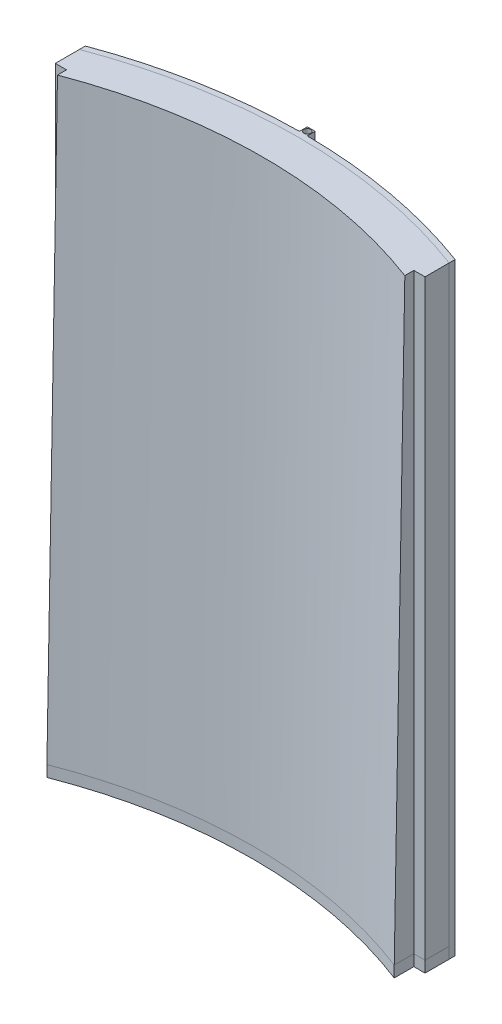
from build123d import *

# Parameters (mm, degrees)
SKETCH1_R                            = 237.5
SKETCH1_R_2                          = 235
BOSS_EXTRUDE1_DEPTH                  = 316.6
SKETCH3_R                            = 235
SKETCH3_R_2                          = 215
BOSS_EXTRUDE2_DEPTH                  = 5
SKETCH7_R                            = 237.5
SKETCH7_R_2                          = 175
BOSS_EXTRUDE3_DEPTH                  = 2.5
SKETCH8_R                            = 235
SKETCH8_R_2                          = 175
BOSS_EXTRUDE4_DEPTH                  = 2.5
SKETCH9_R                            = 235
BOSS_EXTRUDE5_DEPTH                  = 299.1
CUT_EXTRUDE5_REACH                   = 621.561
SKETCH5_W                            = 42.50000009
SKETCH5_H                            = 45.600000066
CUT_EXTRUDE10_START                  = -475.0000001
CUT_EXTRUDE10_DEPTH                  = 475.0000001
CUT_EXTRUDE10_2_DEPTH                = 50.034190288
SKETCH16_W                           = 3.5
SKETCH16_H                           = 7.62
BOSS_EXTRUDE6_DEPTH                  = 3.5
BOSS_EXTRUDE6_DIRECTION_2_REACH      = 286.146
BOSS_EXTRUDE6_DIRECTION_2_END_RADIUS = 237.5
SKETCH17_R                           = 1.5
CUT_EXTRUDE11_DEPTH                  = 371.542926011
CUT_EXTRUDE15_DEPTH                  = 5
CUT_EXTRUDE16_DEPTH                  = 5
SKETCH20_W                           = 10.655659882
SKETCH20_H                           = 29.069608239
CUT_EXTRUDE17_DEPTH                  = 5
SKETCH21_W                           = 2.667965003
SKETCH21_H                           = 29.069608239
CUT_EXTRUDE18_DEPTH                  = 5


# Read off the part's stored shape, not the designer's step: Cut-Extrude10
with BuildPart() as part:
    # Sketch1 → Boss-Extrude1 (new body)
    with BuildSketch(Plane(origin=(0, 0, 0), x_dir=(1, 0, 0), z_dir=(0, 1, 0))):
        with Locations(Location((0, 0, 0), (0, 0, 270))):
            Circle(SKETCH1_R)
        with Locations(Location((0, 0, 0), (0, 0, 270))):
            Circle(SKETCH1_R_2, mode=Mode.SUBTRACT)
    extrude(amount=BOSS_EXTRUDE1_DEPTH)


with BuildPart() as body_2:
    # Sketch3 → Boss-Extrude2 (new body)
    with BuildSketch(Plane(origin=(0, 0, 0), x_dir=(1, 0, 0), z_dir=(0, 1, 0))):
        with Locations(Location((0, 0, 0), (0, 0, 270))):
            Circle(SKETCH3_R)
        with Locations(Location((0, 0, 0), (0, 0, 270))):
            Circle(SKETCH3_R_2, mode=Mode.SUBTRACT)
    extrude(amount=BOSS_EXTRUDE2_DEPTH)


with BuildPart() as body_3:
    # Sketch7 → Boss-Extrude3 (new body)
    with BuildSketch(Plane(origin=(0, 316.6, 0), x_dir=(1, 0, 0), z_dir=(0, 1, 0))):
        with Locations(Location((0, 0, 0), (0, 0, 270))):
            Circle(SKETCH7_R)
        with Locations(Location((0, 0, 0), (0, 0, 270))):
            Circle(SKETCH7_R_2, mode=Mode.SUBTRACT)
    extrude(amount=BOSS_EXTRUDE3_DEPTH)


with BuildPart() as body_4:
    # Sketch8 → Boss-Extrude4 (new body)
    with BuildSketch(Plane(origin=(0, 306.6, 0), x_dir=(1, 0, 0), z_dir=(0, 1, 0))):
        with Locations(Location((0, 0, 0), (0, 0, 270))):
            Circle(SKETCH8_R)
        with Locations(Location((0, 0, 0), (0, 0, 270))):
            Circle(SKETCH8_R_2, mode=Mode.SUBTRACT)
    extrude(amount=-BOSS_EXTRUDE4_DEPTH)


with BuildPart() as body_5:
    # Sketch9 → Boss-Extrude5 (new body)
    with BuildSketch(Plane(origin=(0, 5, 0), x_dir=(1, 0, 0), z_dir=(0, 1, 0))):
        with Locations(Location((0, 0, 0), (0, 0, 270))):
            Circle(SKETCH9_R)
    extrude(amount=BOSS_EXTRUDE5_DEPTH)

    # Sketch13 → Cut-Revolve2 (revolve, cut)
    with BuildSketch(Plane.XY, mode=Mode.PRIVATE) as cut_revolve2_sk:
        Polygon((0, 5), (-215, 5), (-220, 304.1), (0, 304.1), align=None)
    revolve(cut_revolve2_sk.sketch.rotate(Axis((0, 5, 0), (0, 1, 0)), 270), axis=Axis((0, 5, 0), (0, 1, 0)), mode=Mode.SUBTRACT)


with BuildPart() as cut_extrude5_tool:
    # Cut-Extrude5: up to this cone (the profile starts outside it)
    cut_extrude5_end = Plane(origin=(0, 22.8, 0), z_dir=(0, 1, 0)) * Cone(201.299589446, 229.295529243, 1674.717118689, mode=Mode.PRIVATE)
    # Sketch5 → Cut-Extrude5 (new, up to the surface)
    with BuildSketch(Plane.XY.offset(237.5), mode=Mode.PRIVATE) as cut_extrude5_sk1:
        with Locations((0, 22.800000033)):
            Rectangle(SKETCH5_W, SKETCH5_H)
    cut_extrude5_tool1 = extrude(cut_extrude5_sk1.sketch, amount=-CUT_EXTRUDE5_REACH, mode=Mode.PRIVATE) - cut_extrude5_end
    add(cut_extrude5_tool1.solids().sort_by_distance((0, 22.8, 237.5))[0])


with BuildPart() as part_1:
    add(part.part)

    # Cut-Extrude5: cut by cut_extrude5_tool
    add(cut_extrude5_tool.part, mode=Mode.SUBTRACT)


with BuildPart() as body_2_1:
    add(body_2.part)

    # Cut-Extrude5: cut by cut_extrude5_tool
    add(cut_extrude5_tool.part, mode=Mode.SUBTRACT)


with BuildPart() as body_5_1:
    add(body_5.part)

    # Cut-Extrude5: cut by cut_extrude5_tool
    add(cut_extrude5_tool.part, mode=Mode.SUBTRACT)


with BuildPart() as cut_extrude10_tool:
    # Cut-Extrude10 outline → Cut-Extrude10 (new body)
    with BuildSketch(Plane(origin=(0, 0, -237.5), x_dir=(-1, 0, 0), z_dir=(0, 0, -1)).offset(CUT_EXTRUDE10_START)):
        Polygon((-82.5, 269.1), (82.5, 269.1), (82.5, 5), (82.5, 0), (334.900743923, 0), (334.900743923, 341.395751283), (-301.356566018, 341.395751283), (-301.356566018, 0), (-82.5, 0), (-82.5, 5), align=None)
    extrude(amount=CUT_EXTRUDE10_DEPTH)


with BuildPart() as part_2:
    add(part_1.part)

    # Cut-Extrude10: cut by cut_extrude10_tool
    add(cut_extrude10_tool.part, mode=Mode.SUBTRACT)


with BuildPart() as body_2_2:
    add(body_2_1.part)

    # Cut-Extrude10: cut by cut_extrude10_tool
    add(cut_extrude10_tool.part, mode=Mode.SUBTRACT)


with BuildPart() as body_3_1:
    add(body_3.part)

    # Cut-Extrude10: cut by cut_extrude10_tool
    add(cut_extrude10_tool.part, mode=Mode.SUBTRACT)


with BuildPart() as body_4_1:
    add(body_4.part)

    # Cut-Extrude10: cut by cut_extrude10_tool
    add(cut_extrude10_tool.part, mode=Mode.SUBTRACT)


with BuildPart() as body_5_2:
    add(body_5_1.part)

    # Cut-Extrude10: cut by cut_extrude10_tool
    add(cut_extrude10_tool.part, mode=Mode.SUBTRACT)


with BuildPart() as cut_extrude10_2_tool:
    # Cut-Extrude10 2 outline → Cut-Extrude10 2 (new body)
    with BuildSketch(Plane(origin=(0, 0, -237.5), x_dir=(-1, 0, 0), z_dir=(0, 0, -1)).offset(CUT_EXTRUDE10_START)):
        Polygon((82.5, 269.1), (-82.5, 269.1), (-82.5, 0), (-21.250000045, 0), (-21.250000045, 45.600000066), (21.250000045, 45.600000066), (21.250000045, 0), (82.5, 0), align=None)
    extrude(amount=CUT_EXTRUDE10_2_DEPTH)


with BuildPart() as part_3:
    add(part_2.part)

    # Cut-Extrude10 2: cut by cut_extrude10_2_tool
    add(cut_extrude10_2_tool.part, mode=Mode.SUBTRACT)

    # Sketch16 → Boss-Extrude6 (add)
    with BuildSketch(Plane(origin=(0, 0, -237.5), x_dir=(-1, 0, 0), z_dir=(0, 0, -1))):
        with Locations((0, 265.29)):
            Rectangle(SKETCH16_W, SKETCH16_H)
    extrude(amount=BOSS_EXTRUDE6_DEPTH)

    # Boss-Extrude6 direction 2: up to this cylinder (the profile starts outside it)
    boss_extrude6_direction_2_end = Plane(origin=(0, 265.29, 0), z_dir=(0, -1, 0)) * Cylinder(BOSS_EXTRUDE6_DIRECTION_2_END_RADIUS, 1048.292, mode=Mode.PRIVATE)
    # Sketch16 → Boss-Extrude6 direction 2 (add, up to the surface)
    with BuildSketch(Plane(origin=(0, 0, -237.5), x_dir=(-1, 0, 0), z_dir=(0, 0, -1)), mode=Mode.PRIVATE) as boss_extrude6_direction_2_sk1:
        with Locations((0, 265.29)):
            Rectangle(SKETCH16_W, SKETCH16_H)
    boss_extrude6_direction_2_tool1 = extrude(boss_extrude6_direction_2_sk1.sketch, amount=-BOSS_EXTRUDE6_DIRECTION_2_REACH, mode=Mode.PRIVATE) - boss_extrude6_direction_2_end
    add(boss_extrude6_direction_2_tool1.solids().sort_by_distance((0, 265.29, -237.5))[0])
    add(boss_extrude6_direction_2_tool1.solids().sort_by_distance((0, 265.29, -237.5))[1])

    # Sketch17 → Cut-Extrude11 (cut, through all)
    with BuildSketch(Plane(origin=(0, 269.1, 0), x_dir=(1, 0, 0), z_dir=(0, 1, 0))):
        with Locations(Location((0, 239.246776272, 0), (0, 0, 180))):
            Circle(SKETCH17_R)
    extrude(amount=-CUT_EXTRUDE11_DEPTH, mode=Mode.SUBTRACT)


with BuildPart() as body_2_3:
    add(body_2_2.part)

    # Cut-Extrude10 2: cut by cut_extrude10_2_tool
    add(cut_extrude10_2_tool.part, mode=Mode.SUBTRACT)


with BuildPart() as body_5_3:
    add(body_5_2.part)

    # Cut-Extrude10 2: cut by cut_extrude10_2_tool
    add(cut_extrude10_2_tool.part, mode=Mode.SUBTRACT)


with BuildPart() as cut_extrude15_tool:
    # Sketch19 → Cut-Extrude15 (new body)
    with BuildSketch(Plane.ZY.offset(82.5)):
        Polygon((-198.541557363, 0), (-209.292083436, 0), (-209.292083436, 269.1), (-203.252536555, 269.1), (-198.541557363, 5), align=None)
    extrude(amount=-CUT_EXTRUDE15_DEPTH)


with BuildPart() as body_2_4:
    add(body_2_3.part)

    # Cut-Extrude15: cut by cut_extrude15_tool
    add(cut_extrude15_tool.part, mode=Mode.SUBTRACT)


with BuildPart() as body_5_4:
    add(body_5_3.part)

    # Cut-Extrude15: cut by cut_extrude15_tool
    add(cut_extrude15_tool.part, mode=Mode.SUBTRACT)


with BuildPart() as cut_extrude16_tool:
    # Sketch18 → Cut-Extrude16 (new body)
    with BuildSketch(Plane(origin=(82.5, 0, 0), x_dir=(0, 0, -1), z_dir=(1, 0, 0))):
        Polygon((198.541557363, 0), (209.292083436, 0), (209.292083436, 269.1), (203.31417399, 269.1), (198.541557363, 5), align=None)
    extrude(amount=-CUT_EXTRUDE16_DEPTH)


with BuildPart() as body_2_5:
    add(body_2_4.part)

    # Cut-Extrude16: cut by cut_extrude16_tool
    add(cut_extrude16_tool.part, mode=Mode.SUBTRACT)


with BuildPart() as body_5_5:
    add(body_5_4.part)

    # Cut-Extrude16: cut by cut_extrude16_tool
    add(cut_extrude16_tool.part, mode=Mode.SUBTRACT)


with BuildPart() as cut_extrude17_tool:
    # Sketch20 → Cut-Extrude17 (new body)
    with BuildSketch(Plane.ZY.offset(82.5)):
        with Locations((-225.370439451, 202.988321817)):
            Rectangle(SKETCH20_W, SKETCH20_H)
    extrude(amount=-CUT_EXTRUDE17_DEPTH)


with BuildPart() as part_4:
    add(part_3.part)

    # Cut-Extrude17: cut by cut_extrude17_tool
    add(cut_extrude17_tool.part, mode=Mode.SUBTRACT)


with BuildPart() as body_5_6:
    add(body_5_5.part)

    # Cut-Extrude17: cut by cut_extrude17_tool
    add(cut_extrude17_tool.part, mode=Mode.SUBTRACT)


with BuildPart() as cut_extrude18_tool:
    # Sketch21 → Cut-Extrude18 (new body)
    with BuildSketch(Plane.ZY.offset(77.5)):
        with Locations((-221.376592012, 202.988321817)):
            Rectangle(SKETCH21_W, SKETCH21_H)
    extrude(amount=-CUT_EXTRUDE18_DEPTH)


with BuildPart() as part_5:
    add(part_4.part)

    # Cut-Extrude18: cut by cut_extrude18_tool
    add(cut_extrude18_tool.part, mode=Mode.SUBTRACT)


with BuildPart() as body_5_7:
    add(body_5_6.part)

    # Cut-Extrude18: cut by cut_extrude18_tool
    add(cut_extrude18_tool.part, mode=Mode.SUBTRACT)


solid = Compound([body_2_5.part, part_5.part, body_5_7.part])
